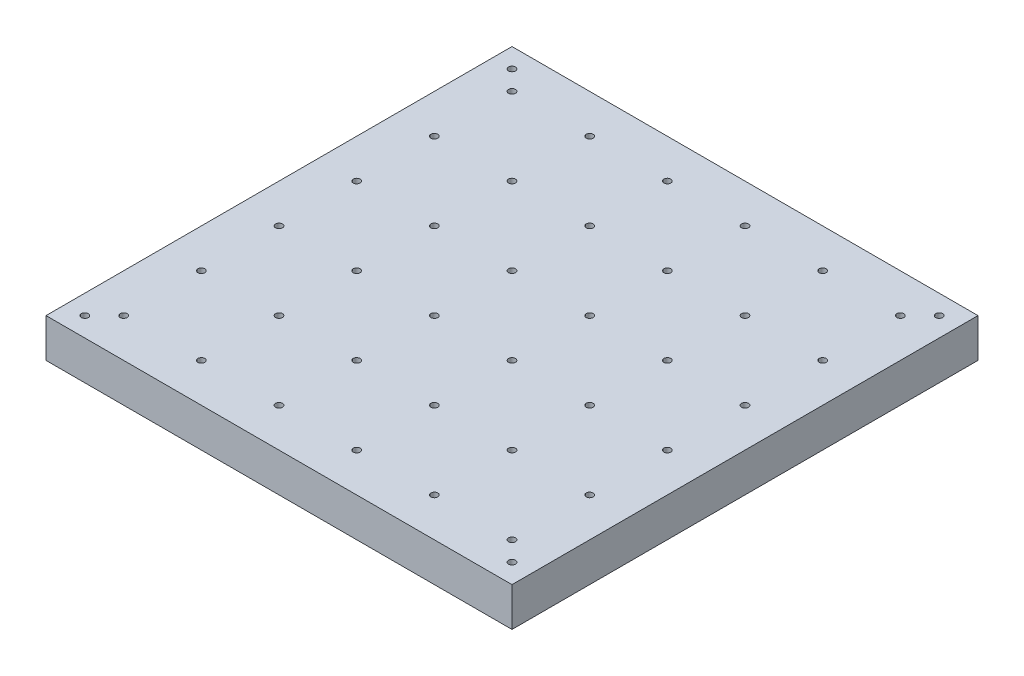
from build123d import *

# Parameters (mm, degrees)
SKETCH1_W             = 152.4
SKETCH1_H             = 152.4
BOSS_EXTRUDE1_DEPTH   = 12.7
F_4_40_TAPPED_HOLE1_D = 2.2606
LPATTERN1_COUNT       = 2
LPATTERN1_PITCH       = 139.7
LPATTERN1_COUNT_DIR2  = 2
LPATTERN1_PITCH_DIR2  = 139.7
F_4_40_TAPPED_HOLE2_D = 2.2606
LPATTERN2_COUNT       = 6
LPATTERN2_PITCH       = 25.4
LPATTERN2_COUNT_DIR2  = 6
LPATTERN2_PITCH_DIR2  = 25.4


with BuildPart() as part:
    # Sketch1 → Boss-Extrude1 (new body)
    with BuildSketch(Plane(origin=(0, 0, 0), x_dir=(1, 0, 0), z_dir=(0, 1, 0))):
        Rectangle(SKETCH1_W, SKETCH1_H)
    extrude(amount=BOSS_EXTRUDE1_DEPTH)

    # #4-40 Tapped Hole1 (through all)
    with Locations(Plane(origin=(69.85, 12.7, 69.85), x_dir=(0, 0, 1), z_dir=(0, 1, 0))):
        with Locations((0, 0)):
            f_4_40_tapped_hole1 = Hole(F_4_40_TAPPED_HOLE1_D / 2)

    # LPattern1: 4-40 Tapped Hole1 2 × 2
    with Locations(*[(-j * LPATTERN1_PITCH_DIR2, 0, -i * LPATTERN1_PITCH) for i in range(LPATTERN1_COUNT) for j in range(LPATTERN1_COUNT_DIR2) if (i, j) != (0, 0)]):
        add(f_4_40_tapped_hole1, mode=Mode.SUBTRACT)

    # #4-40 Tapped Hole2 (through all)
    with Locations(Plane(origin=(63.5, 12.7, 63.5), x_dir=(0, 0, 1), z_dir=(0, 1, 0))):
        with Locations((0, 0)):
            f_4_40_tapped_hole2 = Hole(F_4_40_TAPPED_HOLE2_D / 2)

    # LPattern2: 4-40 Tapped Hole2 6 × 6
    with Locations(*[(-j * LPATTERN2_PITCH_DIR2, 0, -i * LPATTERN2_PITCH) for i in range(LPATTERN2_COUNT) for j in range(LPATTERN2_COUNT_DIR2) if (i, j) != (0, 0)]):
        add(f_4_40_tapped_hole2, mode=Mode.SUBTRACT)


solid = part.part
